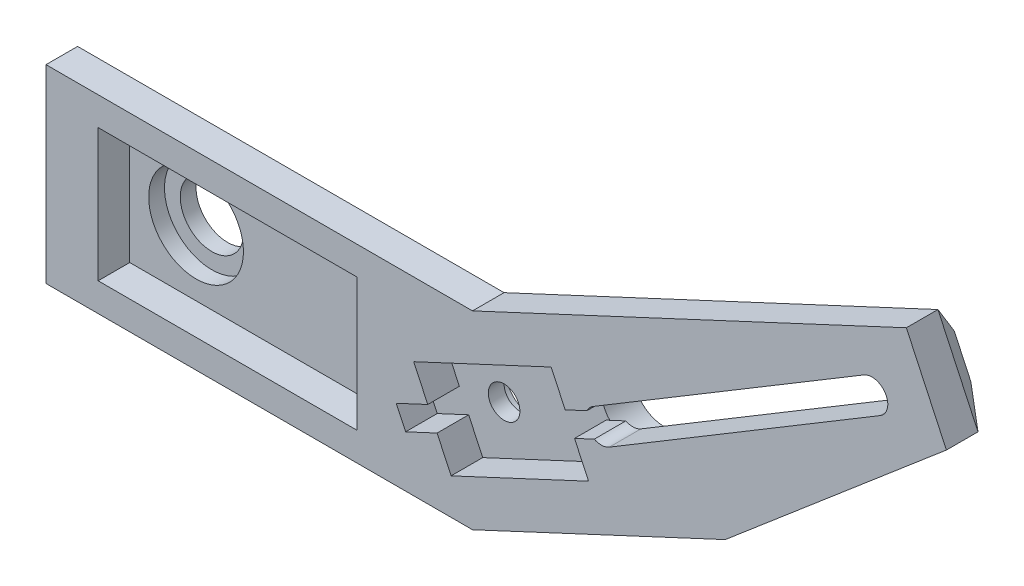
from build123d import *

# Parameters (mm, degrees)
SKETCH1_W                = 57.5
SKETCH1_H                = 30
BOSS_EXTRUDE1_DEPTH      = 30
SKETCH2_W                = 41
SKETCH2_H                = 21
CUT_EXTRUDE1_DEPTH       = 25
SKETCH8_R                = 2
CUT_EXTRUDE6_DEPTH       = 10
SKETCH10_R               = 5
CUT_EXTRUDE8_DEPTH       = 10
BOSS_EXTRUDE4_DEPTH      = 30
SKETCH16_R               = 5
CUT_EXTRUDE10_DEPTH      = 30
CHAMFER5_SIZE            = 5
SKETCH20_R               = 7.5
CUT_EXTRUDE13_DEPTH      = 2.5
CUT_EXTRUDE16_DEPTH      = 122.918629513
CUT_EXTRUDE16_DEPTH_BACK = 122.918629513
SKETCH30_W               = 142.5
SKETCH30_H               = 20
CUT_EXTRUDE17_DEPTH      = 5
CUT_EXTRUDE19_DEPTH      = 124.489525441
CUT_EXTRUDE20_DEPTH      = 5
SKETCH35_R               = 2.5
CUT_EXTRUDE21_DEPTH      = 5
SKETCH36_R               = 5
CUT_EXTRUDE22_DEPTH      = 2.5


with BuildPart() as part:
    # Sketch1 → Boss-Extrude1 (new body)
    with BuildSketch(Plane.XY):
        Rectangle(SKETCH1_W, SKETCH1_H)
    extrude(amount=BOSS_EXTRUDE1_DEPTH)

    # Sketch2 → Cut-Extrude1 (cut)
    with BuildSketch(Plane.XY.offset(30)):
        Rectangle(SKETCH2_W, SKETCH2_H)
    extrude(amount=-CUT_EXTRUDE1_DEPTH, mode=Mode.SUBTRACT)

    # Sketch8 → Cut-Extrude6 (cut)
    with BuildSketch(Plane.XY.offset(30)):
        with Locations((24.35, 6)):
            Circle(SKETCH8_R)
        with Locations(Location((24.35, -6, 0), (0, 0, 180))):
            Circle(SKETCH8_R)
        with Locations((-24.35, -6)):
            Circle(SKETCH8_R)
        with Locations(Location((-24.35, 6, 0), (0, 0, 180))):
            Circle(SKETCH8_R)
    extrude(amount=-CUT_EXTRUDE6_DEPTH, mode=Mode.SUBTRACT)

    # Sketch10 → Cut-Extrude8 (cut)
    with BuildSketch(Plane.XY.offset(5)):
        with Locations((-10, 0)):
            Circle(SKETCH10_R)
    extrude(amount=-CUT_EXTRUDE8_DEPTH, mode=Mode.SUBTRACT)

    # Sketch13 → Boss-Extrude4 (add)
    with BuildSketch(Plane.XY.offset(30)):
        Polygon((28.75, 15), (38.75, 15), (107.410726074, 47.017022383), (113.75, 33.422405577), (78.75, 3.652306326), (38.75, -15), (28.75, -15), align=None)
    extrude(amount=-BOSS_EXTRUDE4_DEPTH)

    # Sketch16 → Cut-Extrude10 (cut)
    with BuildSketch(Plane(origin=(1.175656739, -2.521204013, 0), x_dir=(0.9063077870366488, 0.42261826174070183, 0), z_dir=(-0.42261826174070183, 0.9063077870366488, 0))):
        with Locations(Location((97.217429724, -15, 0), (0, 0, 180))):
            Circle(SKETCH16_R)
        with BuildLine():
            Line((67.217429724, -12.5), (82.217429724, -12.5))
            ThreePointArc((82.217429724, -12.5), (84.717429724, -15), (82.217429724, -17.5))
            Line((82.217429724, -17.5), (67.217429724, -17.5))
            ThreePointArc((67.217429724, -17.5), (64.717429724, -15), (67.217429724, -12.5))
        make_face()
    extrude(amount=-CUT_EXTRUDE10_DEPTH, mode=Mode.SUBTRACT)

    # Chamfer5
    # the kernel refuses this chamfer: 5 mm, written as the material it takes off along each edge
    with BuildSketch(Plane(origin=(-28.75, 27.85841494, 0), x_dir=(-0.027495876610586317, 0, 0.9996219169112968), z_dir=(0, -1, 0))) as chamfer5_piece_1:
        Polygon((CHAMFER5_SIZE * 0.999621916911, -CHAMFER5_SIZE * 0.0274958766106), (-CHAMFER5_SIZE * 0.0274958766106, -CHAMFER5_SIZE * 0.999621916911), (0, 0), align=None)
    extrude(amount=55.71682988, mode=Mode.SUBTRACT)
    with BuildSketch(Plane(origin=(-41.60841494, -15, 0), x_dir=(0, -0.027495876610586317, 0.9996219169112968), z_dir=(1, 0, 0)), Plane(origin=(51.60841494, -15, 30), x_dir=(0, -0.027495876610586317, -0.9996219169112968), z_dir=(-1, 0, 0))) as chamfer5_piece_2:
        Polygon((CHAMFER5_SIZE * 0.999621916911, -CHAMFER5_SIZE * 0.0274958766106), (-CHAMFER5_SIZE * 0.0274958766106, -CHAMFER5_SIZE * 0.999621916911), (0, 0), align=None)
    extrude(amount=93.21682988, mode=Mode.SUBTRACT)
    with BuildSketch(Plane(origin=(90.403681589, 9.086507297, 30), x_dir=(-0.4224584769229526, 0.905965127389214, 0.02749587661058631), z_dir=(-0.9063077870366526, -0.4226182617406939, 0)), Plane(origin=(90.403681589, 9.086507297, 0), x_dir=(0.011620259578202724, -0.024919727083573626, 0.9996219169112968), z_dir=(-0.9063077870366526, -0.4226182617406939, 0))) as chamfer5_piece_3:
        Polygon((CHAMFER5_SIZE * 0.999621916911, CHAMFER5_SIZE * 0.0274958766106), (-CHAMFER5_SIZE * 0.0274958766106, CHAMFER5_SIZE * 0.999621916911), (0, 0), align=None)
    extrude(amount=69.851946638, mode=Mode.SUBTRACT)
    with BuildSketch(Plane(origin=(123.544555766, 41.753402643, 0), x_dir=(-0.6476573741944397, 0.7614354223576539, -0.027495876610586414), z_dir=(-0.7617234170999287, -0.6479023351104763, 0))) as chamfer5_piece_4:
        Polygon((CHAMFER5_SIZE * 0.999621916911, -CHAMFER5_SIZE * 0.0274958766106), (-CHAMFER5_SIZE * 0.0274958766106, -CHAMFER5_SIZE * 0.999621916911), (0, 0), align=None)
    extrude(amount=71.665266299, mode=Mode.SUBTRACT)
    with BuildSketch(Plane(origin=(123.544555766, 41.753402643, 30), x_dir=(-0.6476573741944397, 0.7614354223576539, 0.02749587661058634), z_dir=(-0.7617234170999287, -0.6479023351104763, 0))) as chamfer5_piece_5:
        Polygon((CHAMFER5_SIZE * 0.999621916911, CHAMFER5_SIZE * 0.0274958766106), (-CHAMFER5_SIZE * 0.0274958766106, CHAMFER5_SIZE * 0.999621916911), (0, 0), align=None)
    extrude(amount=71.665266299, mode=Mode.SUBTRACT)
    with BuildSketch(Plane(origin=(101.976525103, 58.670703972, 30), x_dir=(-0.9059651273892108, -0.42245847692295924, 0.027495876610586337), z_dir=(0.42261826174070055, -0.9063077870366495, 0))) as chamfer5_piece_6:
        Polygon((CHAMFER5_SIZE * 0.999621916911, CHAMFER5_SIZE * 0.0274958766106), (-CHAMFER5_SIZE * 0.0274958766106, CHAMFER5_SIZE * 0.999621916911), (0, 0), align=None)
    extrude(amount=40.71682988, mode=Mode.SUBTRACT)
    with BuildSketch(Plane(origin=(101.976525103, 58.670703972, 0), x_dir=(-0.9059651273892108, -0.42245847692295924, -0.027495876610586344), z_dir=(0.42261826174070055, -0.9063077870366495, 0))) as chamfer5_piece_7:
        Polygon((CHAMFER5_SIZE * 0.999621916911, -CHAMFER5_SIZE * 0.0274958766106), (-CHAMFER5_SIZE * 0.0274958766106, -CHAMFER5_SIZE * 0.999621916911), (0, 0), align=None)
    extrude(amount=40.71682988, mode=Mode.SUBTRACT)
    with BuildSketch(Plane(origin=(27.096318411, 9.565799029, 30), x_dir=(0.4224584769229604, -0.9059651273892103, 0.027495876610586313), z_dir=(0.9063077870366489, 0.4226182617407018, 0))) as chamfer5_piece_8_section:
        Polygon((CHAMFER5_SIZE * 0.999621916911, CHAMFER5_SIZE * 0.0274958766106), (-CHAMFER5_SIZE * 0.0274958766106, CHAMFER5_SIZE * 0.999621916911), (0, 0), align=None)
    chamfer5_piece_8 = extrude(amount=101.47555893, mode=Mode.PRIVATE)
    chamfer5_piece_8 = split(chamfer5_piece_8, bisect_by=Plane(origin=(81.150743587, 15, 28.329639499), z_dir=(0, 1, 0)), keep=Keep.TOP, mode=Mode.PRIVATE)
    add(chamfer5_piece_8, mode=Mode.SUBTRACT)
    with BuildSketch(Plane(origin=(27.096318411, 9.565799029, 0), x_dir=(0.4224584769229604, -0.9059651273892103, -0.02749587661058636), z_dir=(0.9063077870366489, 0.4226182617407018, 0))) as chamfer5_piece_9_section:
        Polygon((CHAMFER5_SIZE * 0.999621916911, -CHAMFER5_SIZE * 0.0274958766106), (-CHAMFER5_SIZE * 0.0274958766106, -CHAMFER5_SIZE * 0.999621916911), (0, 0), align=None)
    chamfer5_piece_9 = extrude(amount=101.47555893, mode=Mode.PRIVATE)
    chamfer5_piece_9 = split(chamfer5_piece_9, bisect_by=Plane(origin=(81.150743587, 15, 1.670360501), z_dir=(0, 1, 0)), keep=Keep.TOP, mode=Mode.PRIVATE)
    add(chamfer5_piece_9, mode=Mode.SUBTRACT)
    with BuildSketch(Plane(origin=(-41.60841494, 15, 0), x_dir=(0, -0.9996219169112968, -0.027495876610586372), z_dir=(1, 0, 0))) as chamfer5_piece_10_section:
        Polygon((CHAMFER5_SIZE * 0.999621916911, -CHAMFER5_SIZE * 0.0274958766106), (-CHAMFER5_SIZE * 0.0274958766106, -CHAMFER5_SIZE * 0.999621916911), (0, 0), align=None)
    chamfer5_piece_10 = extrude(amount=93.21682988, mode=Mode.PRIVATE)
    chamfer5_piece_10 = split(chamfer5_piece_10, bisect_by=Plane(origin=(3.719146846, -1.335155097, 1.672660276), z_dir=(-0.4226182617407018, 0.9063077870366489, 0)), keep=Keep.TOP, mode=Mode.PRIVATE)
    add(chamfer5_piece_10, mode=Mode.SUBTRACT)
    with BuildSketch(Plane(origin=(51.60841494, 15, 30), x_dir=(0, -0.9996219169112968, 0.027495876610586317), z_dir=(-1, 0, 0))) as chamfer5_piece_11_section:
        Polygon((CHAMFER5_SIZE * 0.999621916911, -CHAMFER5_SIZE * 0.0274958766106), (-CHAMFER5_SIZE * 0.0274958766106, -CHAMFER5_SIZE * 0.999621916911), (0, 0), align=None)
    chamfer5_piece_11 = extrude(amount=93.21682988, mode=Mode.PRIVATE)
    chamfer5_piece_11 = split(chamfer5_piece_11, bisect_by=Plane(origin=(3.719146846, -1.335155097, 28.327339724), z_dir=(-0.4226182617407018, 0.9063077870366489, 0)), keep=Keep.TOP, mode=Mode.PRIVATE)
    add(chamfer5_piece_11, mode=Mode.SUBTRACT)
    with BuildSketch(Plane(origin=(27.096318411, 9.565799029, 30), x_dir=(0.4224584769229604, -0.9059651273892103, 0.027495876610586313), z_dir=(0.9063077870366489, 0.4226182617407018, 0))) as chamfer5_piece_12a_section:
        Polygon((CHAMFER5_SIZE * 0.999621916911, CHAMFER5_SIZE * 0.0274958766106), (-CHAMFER5_SIZE * 0.0274958766106, CHAMFER5_SIZE * 0.999621916911), (0, 0), align=None)
    chamfer5_piece_12a = extrude(amount=101.47555893, mode=Mode.PRIVATE)
    chamfer5_piece_12a = split(chamfer5_piece_12a, bisect_by=Plane(origin=(35.512062488, 15, 28.462048788), z_dir=(0, -1, 0)), keep=Keep.TOP, mode=Mode.PRIVATE)
    with BuildSketch(Plane(origin=(51.60841494, 15, 30), x_dir=(0, -0.9996219169112968, 0.027495876610586317), z_dir=(-1, 0, 0))) as chamfer5_piece_12b_section:
        Polygon((CHAMFER5_SIZE * 0.999621916911, -CHAMFER5_SIZE * 0.0274958766106), (-CHAMFER5_SIZE * 0.0274958766106, -CHAMFER5_SIZE * 0.999621916911), (0, 0), align=None)
    chamfer5_piece_12b = extrude(amount=93.21682988, mode=Mode.PRIVATE)
    chamfer5_piece_12b = split(chamfer5_piece_12b, bisect_by=Plane(origin=(41.684567981, 16.368411523, 28.462048788), z_dir=(0.4226182617407018, -0.9063077870366489, 0)), keep=Keep.TOP, mode=Mode.PRIVATE)
    chamfer5_piece_12 = chamfer5_piece_12a & chamfer5_piece_12b
    add(chamfer5_piece_12, mode=Mode.SUBTRACT)
    with BuildSketch(Plane(origin=(27.096318411, 9.565799029, 0), x_dir=(0.4224584769229604, -0.9059651273892103, -0.02749587661058636), z_dir=(0.9063077870366489, 0.4226182617407018, 0))) as chamfer5_piece_13a_section:
        Polygon((CHAMFER5_SIZE * 0.999621916911, -CHAMFER5_SIZE * 0.0274958766106), (-CHAMFER5_SIZE * 0.0274958766106, -CHAMFER5_SIZE * 0.999621916911), (0, 0), align=None)
    chamfer5_piece_13a = extrude(amount=101.47555893, mode=Mode.PRIVATE)
    chamfer5_piece_13a = split(chamfer5_piece_13a, bisect_by=Plane(origin=(35.512062488, 15, 1.537951212), z_dir=(0, -1, 0)), keep=Keep.TOP, mode=Mode.PRIVATE)
    with BuildSketch(Plane(origin=(-41.60841494, 15, 0), x_dir=(0, -0.9996219169112968, -0.027495876610586372), z_dir=(1, 0, 0))) as chamfer5_piece_13b_section:
        Polygon((CHAMFER5_SIZE * 0.999621916911, -CHAMFER5_SIZE * 0.0274958766106), (-CHAMFER5_SIZE * 0.0274958766106, -CHAMFER5_SIZE * 0.999621916911), (0, 0), align=None)
    chamfer5_piece_13b = extrude(amount=93.21682988, mode=Mode.PRIVATE)
    chamfer5_piece_13b = split(chamfer5_piece_13b, bisect_by=Plane(origin=(41.684567981, 16.368411523, 1.537951212), z_dir=(0.4226182617407018, -0.9063077870366489, 0)), keep=Keep.TOP, mode=Mode.PRIVATE)
    chamfer5_piece_13 = chamfer5_piece_13a & chamfer5_piece_13b
    add(chamfer5_piece_13, mode=Mode.SUBTRACT)

    # Sketch20 → Cut-Extrude13 (cut)
    with BuildSketch(Plane.XY.offset(5)):
        with Locations((-10, 0)):
            Circle(SKETCH20_R)
    extrude(amount=-CUT_EXTRUDE13_DEPTH, mode=Mode.SUBTRACT)

    # Sketch30 → Cut-Extrude16 (cut, two sides: drawn at the far end of the back side and taken through both)
    with BuildSketch(Plane(origin=(0, 15, 0), x_dir=(1, 0, 0), z_dir=(0, 1, 0)).offset(-CUT_EXTRUDE16_DEPTH_BACK)):
        with Locations((42.5, -20)):
            Rectangle(SKETCH30_W, SKETCH30_H)
    extrude(amount=CUT_EXTRUDE16_DEPTH + CUT_EXTRUDE16_DEPTH_BACK, mode=Mode.SUBTRACT)

    # Sketch31 → Cut-Extrude17 (cut)
    with BuildSketch(Plane.XY.offset(10)):
        Polygon((29.447517659, 3.385826677), (31.666263533, -1.372289205), (53.417650422, 8.770549077), (51.198904547, 13.528664959), align=None)
        Polygon((54.896814338, 5.598471822), (33.145427449, -4.544366459), (35.364173323, -9.302482341), (57.115560212, 0.84035594), align=None)
        Polygon((26.681570704, -3.696689644), (28.16073462, -6.868766899), (33.145427449, -4.544366459), (31.666263533, -1.372289205), align=None)
        Polygon((31.666263533, -1.372289205), (33.145427449, -4.544366459), (54.896814338, 5.598471822), (53.417650422, 8.770549077), align=None)
        Polygon((53.417650422, 8.770549077), (54.896814338, 5.598471822), (59.881507166, 7.922872262), (58.40234325, 11.094949516), align=None)
    extrude(amount=-CUT_EXTRUDE17_DEPTH, mode=Mode.SUBTRACT)

    # Sketch33 → Cut-Extrude19 (cut, through all)
    with BuildSketch(Plane.XY):
        with BuildLine():
            Line((60.40363349, 7.153909711), (103.261998525, 32.905813456))
            ThreePointArc((103.261998525, 32.905813456), (104.11732159, 36.336326895), (100.686808151, 37.19164996))
            Line((100.686808151, 37.19164996), (57.828443116, 11.439746214))
            ThreePointArc((57.828443116, 11.439746214), (56.973120051, 8.009232775), (60.40363349, 7.153909711))
        make_face()
    extrude(amount=CUT_EXTRUDE19_DEPTH, mode=Mode.SUBTRACT)

    # Sketch34 → Cut-Extrude20 (cut)
    with BuildSketch(Plane(origin=(0, 0, 0), x_dir=(-1, 0, 0), z_dir=(0, 0, -1))):
        with BuildLine():
            Line((-99.399212963, 39.334568211), (-56.540847928, 13.582664466))
            ThreePointArc((-56.540847928, 13.582664466), (-54.830201799, 6.721637588), (-61.691228677, 5.010991459))
            Line((-61.691228677, 5.010991459), (-104.549593712, 30.762895204))
            ThreePointArc((-104.549593712, 30.762895204), (-106.260239841, 37.623922082), (-99.399212963, 39.334568211))
        make_face()
    extrude(amount=-CUT_EXTRUDE20_DEPTH, mode=Mode.SUBTRACT)

    # Sketch35 → Cut-Extrude21 (cut)
    with BuildSketch(Plane(origin=(0, 0, 0), x_dir=(-1, 0, 0), z_dir=(0, 0, -1))):
        with Locations((-38.75, 0)):
            Circle(SKETCH35_R)
    extrude(amount=-CUT_EXTRUDE21_DEPTH, mode=Mode.SUBTRACT)

    # Sketch36 → Cut-Extrude22 (cut)
    with BuildSketch(Plane(origin=(0, 0, 0), x_dir=(-1, 0, 0), z_dir=(0, 0, -1))):
        with Locations((-38.75, 0)):
            Circle(SKETCH36_R)
    extrude(amount=-CUT_EXTRUDE22_DEPTH, mode=Mode.SUBTRACT)


solid = part.part
